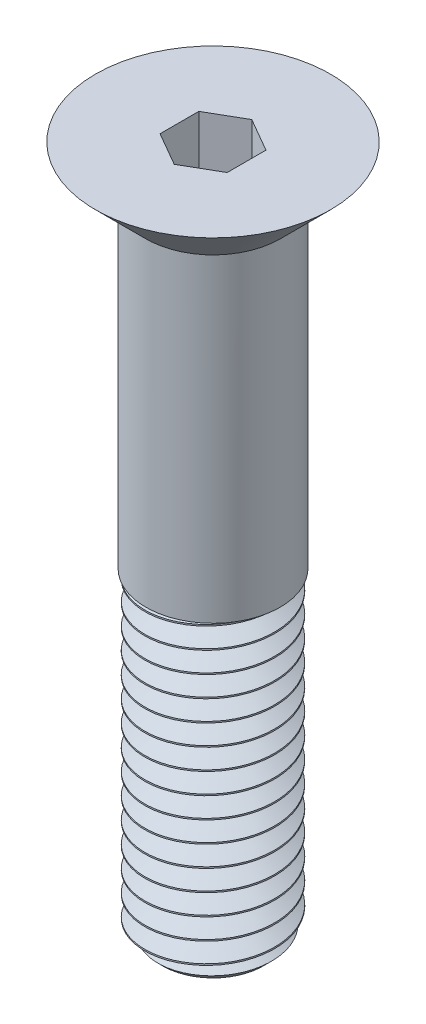
from build123d import *

# Parameters (mm, degrees)
SKETCH1_R           = 4
SKETCH1_R_2         = 1
BOSS_EXTRUDE1_DEPTH = 19
CHAMFER1_SIZE       = 1
CUT_SWEEP1_PITCH    = 1.25
CUT_EXTRUDE1_DEPTH  = 5
SKETCH7_R           = 1
CUT_EXTRUDE2_DEPTH  = 20.5
CHAMFER2_SIZE       = 2
SKETCH8_R           = 4
SKETCH8_R_2         = 3.8646875
CUT_EXTRUDE3_DEPTH  = 25.124676164


with BuildPart() as part:
    # Sketch1 → Boss-Extrude1 (new body)
    with BuildSketch(Plane(origin=(0, 0, 0), x_dir=(1, 0, 0), z_dir=(0, 1, 0))):
        with Locations(Location((0, 0, 0), (0, 0, 270))):
            Circle(SKETCH1_R)
        with Locations(Location((0, 0, 0), (0, 0, 270))):
            Circle(SKETCH1_R_2, mode=Mode.SUBTRACT)
    extrude(amount=BOSS_EXTRUDE1_DEPTH)

    # Chamfer1
    chamfer1_edges = [part.edges().sort_by_distance(p)[0] for p in [
        (0, 0, -4),
    ]]
    chamfer(chamfer1_edges, length=CHAMFER1_SIZE)

    # Cut-Sweep1: the profile of Sketch3 screwed along a right-hand helix of 24 turns, 8 arcs to a turn; built about Z, then put on its axis
    cut_sweep1_z = Axis((0, 0, 0), (0, 0, 1))
    cut_sweep1_corners = [(3.938610261, 0, 3.159847788), (3.938610261, 0, 4.409811121), (2.856110261, 0, 3.784829454)]
    with BuildLine(mode=Mode.PRIVATE) as cut_sweep1_profile:
        Line(cut_sweep1_corners[0], cut_sweep1_corners[1])
        Line(cut_sweep1_corners[1], cut_sweep1_corners[2])
        Line(cut_sweep1_corners[2], cut_sweep1_corners[0])
    cut_sweep1_cap = Face(cut_sweep1_profile.wire())
    cut_sweep1_turn_angles = [0, 22.5, 45, 67.5, 90, 112.5, 135, 157.5, 180, 202.5, 225, 247.5, 270, 292.5, 315, 337.5, 360]
    cut_sweep1_turn_weights = [1, 0.9238795325112867, 1, 0.9238795325112867, 1, 0.9238795325112867, 1, 0.9238795325112867, 1, 0.9238795325112867, 1, 0.9238795325112867, 1, 0.9238795325112867, 1, 0.9238795325112867, 1]
    cut_sweep1_turn_rails = [Edge.make_bspline([Vector(p[0], p[1], 0).rotate(cut_sweep1_z, cut_sweep1_turn_angles[k]) / cut_sweep1_turn_weights[k] + Vector(0, 0, p[2] + CUT_SWEEP1_PITCH * cut_sweep1_turn_angles[k] / 360) for k in range(17)], [0, 0, 0, 1, 1, 2, 2, 3, 3, 4, 4, 5, 5, 6, 6, 7, 7, 8, 8, 8], 2, cut_sweep1_turn_weights) for p in cut_sweep1_corners]
    cut_sweep1_turn_sides = [Face.make_surface_from_curves(cut_sweep1_turn_rails[p[0]], cut_sweep1_turn_rails[p[1]]) for p in [(0, 1), (1, 2), (2, 0)]]
    cut_sweep1 = Plane(origin=(0, 29, 0), x_dir=(-1, 0, 0), z_dir=(0, -1, 0)) * Solid(Shell([*[p.moved(Location((0, 0, CUT_SWEEP1_PITCH * i))) for i in range(24) for p in cut_sweep1_turn_sides], cut_sweep1_cap, cut_sweep1_cap.rotate(cut_sweep1_z, 8640).moved(Location((0, 0, CUT_SWEEP1_PITCH * 8640 / 360)))]))
    add(cut_sweep1, mode=Mode.SUBTRACT)

    # Sketch5 → Revolve1 (revolve)
    with BuildSketch(Plane.XY, mode=Mode.PRIVATE) as revolve1_sk:
        Polygon((0, 41), (7, 41), (4, 38), (4, 19), (0, 19), align=None)
    revolve(revolve1_sk.sketch.rotate(Axis((0, 0, 0), (0, 1, 0)), 270), axis=Axis((0, 0, 0), (0, 1, 0)))

    # Sketch6 → Cut-Extrude1 (cut)
    with BuildSketch(Plane(origin=(0, 41, 0), x_dir=(1, 0, 0), z_dir=(0, 1, 0))):
        Polygon((0, 2.309401077), (-2, 1.154700538), (-2, -1.154700538), (0, -2.309401077), (2, -1.154700538), (2, 1.154700538), align=None)
    extrude(amount=-CUT_EXTRUDE1_DEPTH, mode=Mode.SUBTRACT)

    # Sketch7 → Cut-Extrude2 (cut)
    with BuildSketch(Plane.XZ):
        with Locations(Location((0, 0, 0), (0, 0, 270))):
            Circle(SKETCH7_R)
    extrude(amount=-CUT_EXTRUDE2_DEPTH, mode=Mode.SUBTRACT)

    # Chamfer2
    # the kernel refuses this chamfer: 2 mm, written as the material it takes off along each edge
    with BuildSketch(Plane(origin=(0, 0, 0), x_dir=(0, 0, 1), z_dir=(-1, 0, 0))) as chamfer2_piece_1:
        Polygon((1 + CHAMFER2_SIZE, 0), (1, CHAMFER2_SIZE), (1, 0), align=None)
    revolve(axis=Axis((0, 0, 0), (0, 1, 0)), revolution_arc=180, mode=Mode.SUBTRACT)
    with BuildSketch(Plane(origin=(0, 0, 0), x_dir=(0, 0, -1), z_dir=(1, 0, 0))) as chamfer2_piece_2:
        Polygon((1 + CHAMFER2_SIZE, 0), (1, CHAMFER2_SIZE), (1, 0), align=None)
    revolve(axis=Axis((0, 0, 0), (0, 1, 0)), revolution_arc=180, mode=Mode.SUBTRACT)

    # Sketch8 → Cut-Extrude3 (cut, through all)
    with BuildSketch(Plane.XZ.offset(-19)):
        with Locations(Location((0, 0, 0), (0, 0, 270))):
            Circle(SKETCH8_R)
        Circle(SKETCH8_R_2, mode=Mode.SUBTRACT)
    extrude(amount=CUT_EXTRUDE3_DEPTH, mode=Mode.SUBTRACT)


solid = part.part
